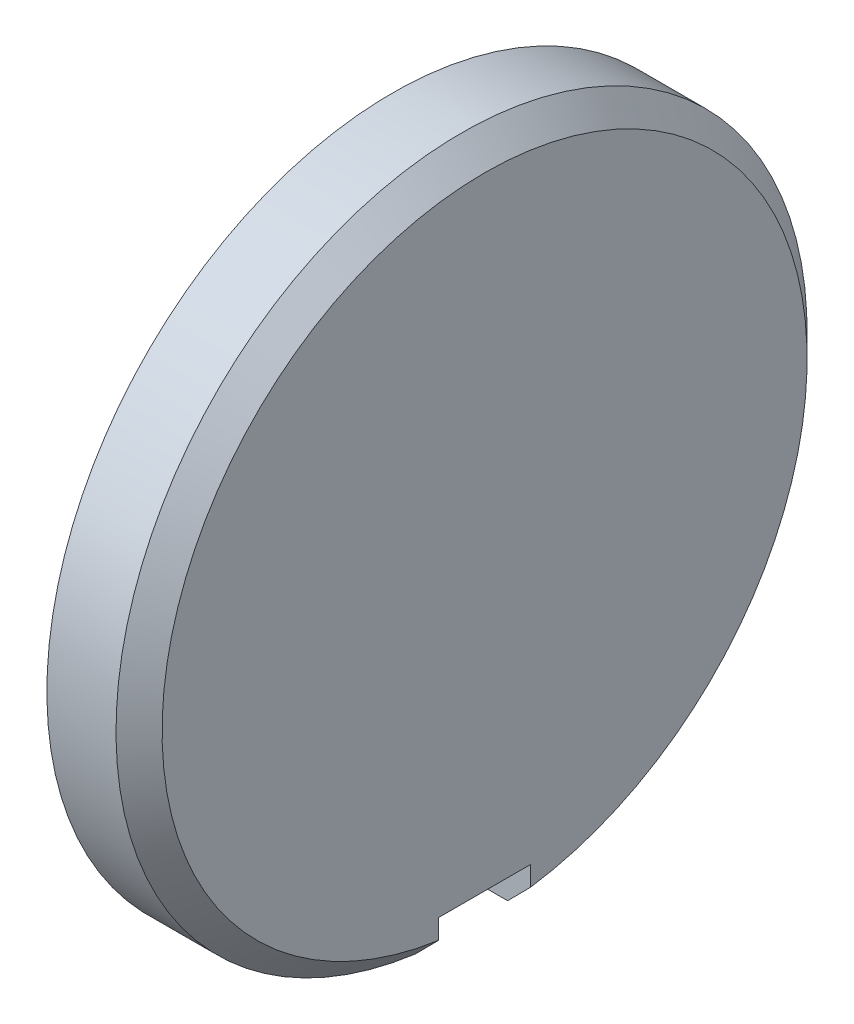
from build123d import *

# Parameters (mm, degrees)
BOSS_EXTRUDE1_START = 62.8
SKETCH2_W           = 1.28
SKETCH2_H           = 0.8
BOSS_EXTRUDE1_DEPTH = 6.4
BOSS_EXTRUDE2_START = 65.6
SKETCH3_W           = 1.28
SKETCH3_H           = 6.4
BOSS_EXTRUDE2_DEPTH = 0.8
BOSS_EXTRUDE3_START = 65.2
SKETCH4_W           = 1.8
SKETCH4_H           = 0.9
BOSS_EXTRUDE3_DEPTH = 1.6


with BuildPart() as part:
    # Sketch1 → Revolve1 (revolve)
    with BuildSketch(Plane.XY.offset(66)):
        Polygon((58.2, 20.3), (59.4, 20.3), (59.4, 18), (61, 18), (61, 23.6), (60.6, 24), (59.4, 24), (59.4, 21), (58.2, 21), align=None)
    revolve(axis=Axis((53.2, 18, 66), (1, 0, 0)))


with BuildPart() as body_2:
    # Sketch2 → Boss-Extrude1 (new body)
    with BuildSketch(Plane.XY.offset(BOSS_EXTRUDE1_START)):
        with Locations((58.74, 18)):
            Rectangle(SKETCH2_W, SKETCH2_H)
    extrude(amount=BOSS_EXTRUDE1_DEPTH)


with BuildPart() as part_1:
    add(part.part)

    # Combine1: cut body 2
    add(body_2.part, mode=Mode.SUBTRACT)


with BuildPart() as body_2_2:
    # Sketch3 → Boss-Extrude2 (new body)
    with BuildSketch(Plane.XY.offset(BOSS_EXTRUDE2_START)):
        with Locations((58.74, 18)):
            Rectangle(SKETCH3_W, SKETCH3_H)
    extrude(amount=BOSS_EXTRUDE2_DEPTH)


with BuildPart() as part_2:
    add(part_1.part)

    # Combine2: cut body 2 2
    add(body_2_2.part, mode=Mode.SUBTRACT)


with BuildPart() as body_2_3:
    # Sketch4 → Boss-Extrude3 (new body)
    with BuildSketch(Plane.XY.offset(BOSS_EXTRUDE3_START)):
        with Locations((60.2, 12.35)):
            Rectangle(SKETCH4_W, SKETCH4_H)
    extrude(amount=BOSS_EXTRUDE3_DEPTH)


with BuildPart() as part_3:
    add(part_2.part)

    # Combine3: cut body 2 3
    add(body_2_3.part, mode=Mode.SUBTRACT)


solid = part_3.part
